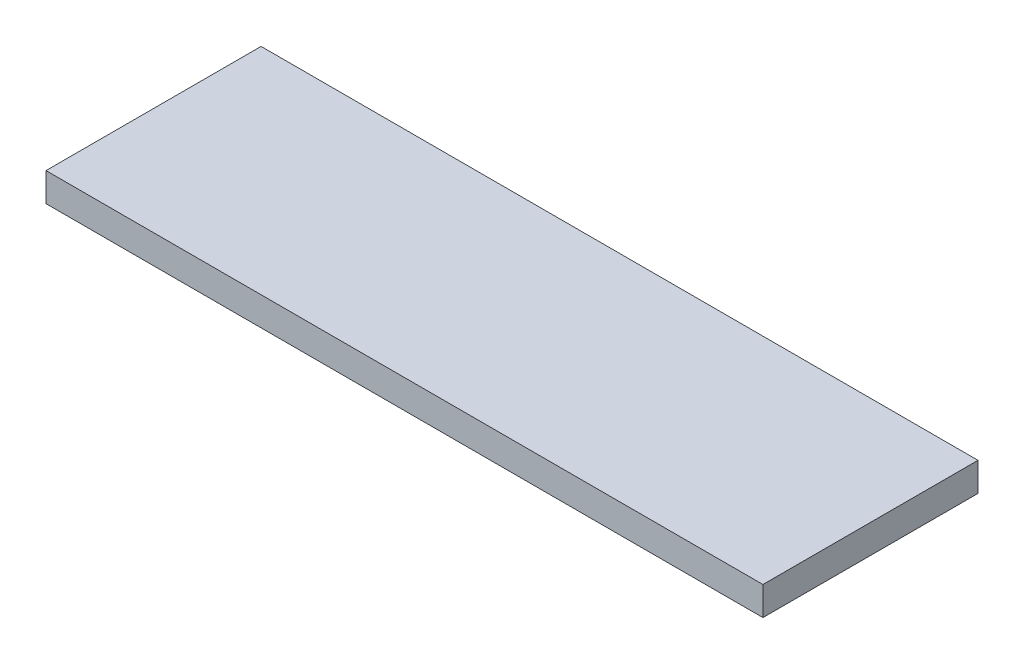
from build123d import *

# Parameters (mm, degrees)
SKETCH1_W           = 150
SKETCH1_H           = 45
BOSS_EXTRUDE1_DEPTH = 6


with BuildPart() as part:
    # Sketch1 → Boss-Extrude1 (new body)
    with BuildSketch(Plane(origin=(0, 0, 0), x_dir=(1, 0, 0), z_dir=(0, 1, 0))):
        with Locations((75, 22.5)):
            Rectangle(SKETCH1_W, SKETCH1_H)
    extrude(amount=BOSS_EXTRUDE1_DEPTH)


solid = part.part
